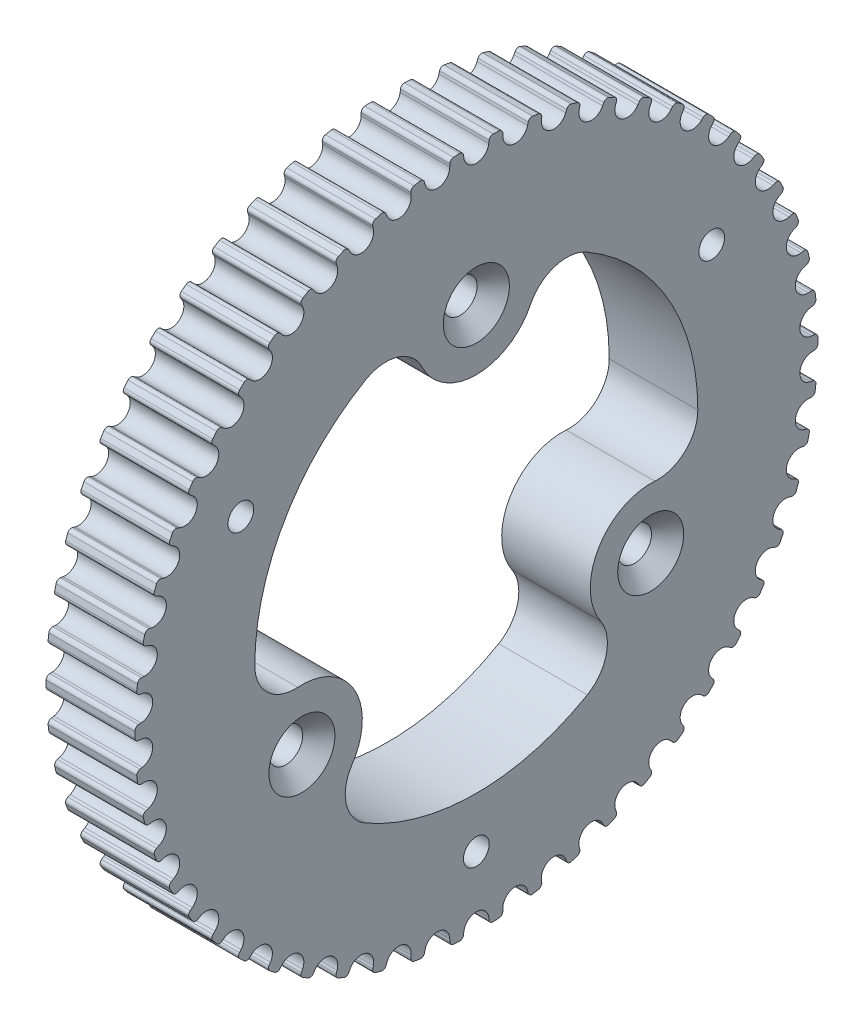
from build123d import *

# Parameters (mm, degrees)
SKETCH_1_W               = 11
SKETCH_1_H               = 24.898
CUT_EXTRUDE_2_REACH      = 62.96
PATTERN_CIRCULAR_3_COUNT = 54
SKETCH_7_R               = 2.1
CUT_EXTRUDE_3_DEPTH      = 61.92514
PATTERN_CIRCULAR_4_COUNT = 3
CHAMFER_1_SIZE           = 2
SKETCH_9_R               = 1.6
CUT_EXTRUDE_4_DEPTH      = 61.92514
CUT_EXTRUDE_5_DEPTH      = 61.92514
PATTERN_CIRCULAR_5_COUNT = 3
FILLET_1_R               = 5


with BuildPart() as part:
    # 草图1 → 旋转1 (revolve)
    with BuildSketch(Plane.XY, mode=Mode.PRIVATE) as revolve_1_sk:
        with Locations((5.5, 29.949)):
            Rectangle(SKETCH_1_W, SKETCH_1_H)
    revolve(revolve_1_sk.sketch.rotate(Axis((0, 0, 0), (1, 0, 0)), 90), axis=Axis((0, 0, 0), (1, 0, 0)))

    # 草图6 → 切除-拉伸2 (cut, up to next)
    with BuildSketch(Plane(origin=(0, 0, 0), x_dir=(0, 0, -1), z_dir=(1, 0, 0)), mode=Mode.PRIVATE) as cut_extrude_2_sk1:
        with BuildLine():
            Line((1.587390135, 41.925661063), (1.548371997, 41.607883824))
            ThreePointArc((1.548371997, 41.607883824), (0, 40.238), (-1.548371997, 41.607883824))
            Line((-1.548371997, 41.607883824), (-1.587390135, 41.925661063))
            ThreePointArc((-1.587390135, 41.925661063), (-1.754703668, 42.234385593), (-2.087444854, 42.346581656))
            ThreePointArc((-2.087444854, 42.346581656), (-2.327120349, 42.334086914), (-2.566721276, 42.320235655))
            Line((-2.566721276, 42.320235655), (-2.763369264, 43.921804997))
            ThreePointArc((-2.763369264, 43.921804997), (0, 44.00864874), (2.763369264, 43.921804997))
            Line((2.763369264, 43.921804997), (2.566721276, 42.320235655))
            ThreePointArc((2.566721276, 42.320235655), (2.327120349, 42.334086914), (2.087444854, 42.346581656))
            ThreePointArc((2.087444854, 42.346581656), (1.754703668, 42.234385593), (1.587390135, 41.925661063))
        make_face()
    cut_extrude_2_tool1 = extrude(cut_extrude_2_sk1.sketch, amount=CUT_EXTRUDE_2_REACH, mode=Mode.PRIVATE) & part.part
    cut_extrude_2 = cut_extrude_2_tool1.solids().sort_by_distance((0, 42.492252, 0))[0]
    add(cut_extrude_2, mode=Mode.SUBTRACT)

    # 阵列(圆周)3: 切除-拉伸2 ×54 about axis
    pattern_circular_3_axis = Axis((0, 0, 0), (1, 0, 0))
    for i in range(1, PATTERN_CIRCULAR_3_COUNT):
        add(cut_extrude_2.rotate(pattern_circular_3_axis, i * 360 / PATTERN_CIRCULAR_3_COUNT), mode=Mode.SUBTRACT)

    # 草图7 → 切除-拉伸3 (cut, through all)
    with BuildSketch(Plane(origin=(11, 0, 0), x_dir=(0, 0, -1), z_dir=(1, 0, 0))):
        with Locations((0, 25)):
            Circle(SKETCH_7_R)
    cut_extrude_3 = extrude(amount=-CUT_EXTRUDE_3_DEPTH, mode=Mode.SUBTRACT)

    # 阵列(圆周)4: 切除-拉伸3 ×3 about axis
    pattern_circular_4_axis = Axis((0, 0, 0), (1, 0, 0))
    for i in range(1, PATTERN_CIRCULAR_4_COUNT):
        add(cut_extrude_3.rotate(pattern_circular_4_axis, i * 360 / PATTERN_CIRCULAR_4_COUNT), mode=Mode.SUBTRACT)

    # 倒角1
    chamfer_1_edges = [part.edges().sort_by_distance(p)[0] for p in [
        (11, 25, 2.1),
        (11, -10.681346652, -22.700635095),
        (11, -14.318653348, 20.600635095),
    ]]
    chamfer(chamfer_1_edges, length=CHAMFER_1_SIZE)

    # 草图9 → 切除-拉伸4 (cut, through all)
    with BuildSketch(Plane(origin=(11, 0, 0), x_dir=(0, 0, -1), z_dir=(1, 0, 0))):
        with Locations((0, -33.75)):
            Circle(SKETCH_9_R)
    cut_extrude_4 = extrude(amount=-CUT_EXTRUDE_4_DEPTH, mode=Mode.SUBTRACT)

    # 草图10 → 切除-拉伸5 (cut, through all)
    with BuildSketch(Plane(origin=(11, 0, 0), x_dir=(0, 0, -1), z_dir=(1, 0, 0))):
        with BuildLine():
            ThreePointArc((-19.275438586, -19.613961031), (-14.637978404, -15.159444704), (-15.155444566, -8.75))
            ThreePointArc((-15.155444566, -8.75), (0, -17.5), (15.155444566, -8.75))
            ThreePointArc((15.155444566, -8.75), (14.637978404, -15.159444704), (19.275438586, -19.613961031))
            ThreePointArc((19.275438586, -19.613961031), (0, -27.5), (-19.275438586, -19.613961031))
        make_face()
    cut_extrude_5 = extrude(amount=-CUT_EXTRUDE_5_DEPTH, mode=Mode.SUBTRACT)

    # 阵列(圆周)5: 切除-拉伸4, 切除-拉伸5 ×3 about axis
    pattern_circular_5_axis = Axis((0, 0, 0), (1, 0, 0))
    add([cut_extrude_4.rotate(pattern_circular_5_axis, i * 360 / PATTERN_CIRCULAR_5_COUNT) for i in range(1, PATTERN_CIRCULAR_5_COUNT)], mode=Mode.SUBTRACT)
    add([cut_extrude_5.rotate(pattern_circular_5_axis, i * 360 / PATTERN_CIRCULAR_5_COUNT) for i in range(1, PATTERN_CIRCULAR_5_COUNT)], mode=Mode.SUBTRACT)

    # 圆角1
    fillet_1_edges = [part.edges().sort_by_distance(p)[0] for p in [
        (5.5, -19.613961031, -19.275438586),
        (5.5, -19.613961031, 19.275438586),
        (5.5, -6.886038969, 26.623907814),
        (5.5, 26.5, 7.348469228),
        (5.5, 26.5, -7.348469228),
        (5.5, -6.886038969, -26.623907814),
    ]]
    fillet(fillet_1_edges, radius=FILLET_1_R)


solid = part.part
